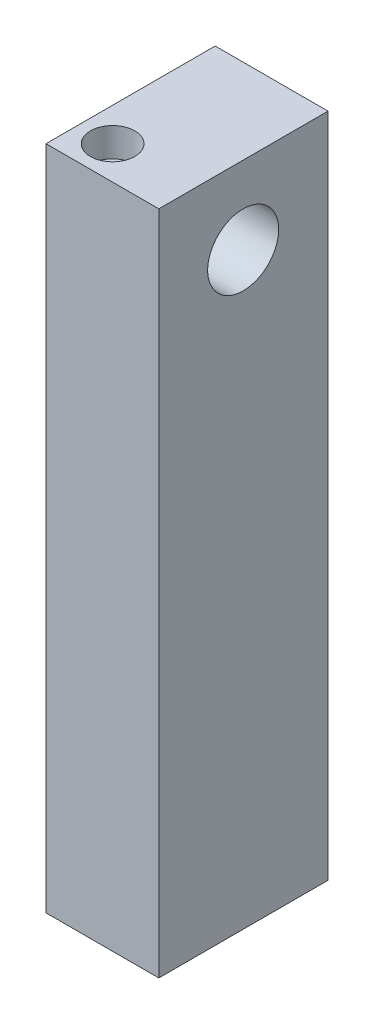
from build123d import *

# Parameters (mm, degrees)
SKETCH1_W           = 50.8
SKETCH1_H           = 76.2
BOSS_EXTRUDE1_DEPTH = 300
SKETCH2_R           = 16
CUT_EXTRUDE1_DEPTH  = 150
SKETCH4_R           = 5.25
CUT_EXTRUDE3_DEPTH  = 60
SKETCH6_R           = 10
CUT_EXTRUDE4_DEPTH  = 13


with BuildPart() as part:
    # Sketch1 → Boss-Extrude1 (new body)
    with BuildSketch(Plane(origin=(0, 0, 0), x_dir=(1, 0, 0), z_dir=(0, 1, 0))):
        with Locations((25.4, 38.1)):
            Rectangle(SKETCH1_W, SKETCH1_H)
    extrude(amount=BOSS_EXTRUDE1_DEPTH)

    # Sketch2 → Cut-Extrude1 (cut)
    with BuildSketch(Plane(origin=(50.8, 0, 0), x_dir=(0, 0, -1), z_dir=(1, 0, 0))):
        with Locations((38, 265)):
            Circle(SKETCH2_R)
    extrude(amount=-CUT_EXTRUDE1_DEPTH, mode=Mode.SUBTRACT)

    # Sketch4 → Cut-Extrude3 (cut)
    with BuildSketch(Plane(origin=(0, 300, 0), x_dir=(1, 0, 0), z_dir=(0, 1, 0))):
        with Locations((15, 15)):
            Circle(SKETCH4_R)
    extrude(amount=-CUT_EXTRUDE3_DEPTH, mode=Mode.SUBTRACT)

    # Sketch6 → Cut-Extrude4 (cut)
    with BuildSketch(Plane(origin=(0, 300, 0), x_dir=(1, 0, 0), z_dir=(0, 1, 0))):
        with Locations((15, 15)):
            Circle(SKETCH6_R)
    extrude(amount=-CUT_EXTRUDE4_DEPTH, mode=Mode.SUBTRACT)


solid = part.part
